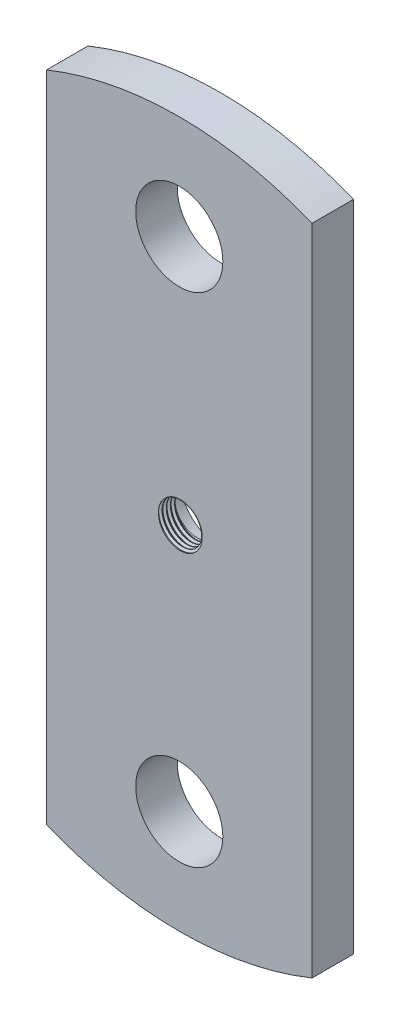
from build123d import *

# Parameters (mm, degrees)
SKETCH1_R           = 10.5
SKETCH1_R_2         = 10
SKETCH1_R_3         = 5
BOSS_EXTRUDE1_DEPTH = 10
SKETCH1_7_R         = 10
SKETCH1_7_R_2       = 5
CUT_EXTRUDE2_DEPTH  = 5.5
THREAD1_PITCH       = 1


with BuildPart() as part:
    # Sketch1 → Boss-Extrude1 (new body)
    # profile 1 of 2: a face of its own
    with BuildSketch(Plane.XY):
        with BuildLine():
            Line((-32, 78.74642849), (-32, -78.74642849))
            ThreePointArc((-32, -78.74642849), (0, -85), (32, -78.74642849))
            Line((32, -78.74642849), (32, 78.74642849))
            ThreePointArc((32, 78.74642849), (0, 85), (-32, 78.74642849))
        make_face()
        with Locations((0, -60)):
            Circle(SKETCH1_R, mode=Mode.SUBTRACT)
        with Locations((0, 60)):
            Circle(SKETCH1_R, mode=Mode.SUBTRACT)
        Circle(SKETCH1_R_2, mode=Mode.SUBTRACT)
    # profile 2 of 2: a face of its own
    with BuildSketch(Plane.XY):
        Circle(SKETCH1_R_2)
        Circle(SKETCH1_R_3, mode=Mode.SUBTRACT)
    extrude(amount=BOSS_EXTRUDE1_DEPTH)

    # Sketch1<7> → Cut-Extrude2 (cut)
    with BuildSketch(Plane.XY):
        Circle(SKETCH1_7_R)
        Circle(SKETCH1_7_R_2, mode=Mode.SUBTRACT)
    extrude(amount=CUT_EXTRUDE2_DEPTH, mode=Mode.SUBTRACT)

    # Thread1: the profile of Thread Profile1 profile screwed along a right-hand helix of 30 turns, 8 arcs to a turn; built about Z, then put on its axis
    thread1_z = Axis((0, 0, 0), (0, 0, 1))
    thread1_corners = [(4.9997, 0, -0.000173205), (4.9997, 0, 0.875173202), (5.541265875, 0, 0.562499999), (5.541265875, 0, 0.312499999)]
    with BuildLine(mode=Mode.PRIVATE) as thread1_profile:
        Line(thread1_corners[0], thread1_corners[1])
        Line(thread1_corners[1], thread1_corners[2])
        Line(thread1_corners[2], thread1_corners[3])
        Line(thread1_corners[3], thread1_corners[0])
    thread1_cap = Face(thread1_profile.wire())
    thread1_turn_angles = [0, 22.5, 45, 67.5, 90, 112.5, 135, 157.5, 180, 202.5, 225, 247.5, 270, 292.5, 315, 337.5, 360]
    thread1_turn_weights = [1, 0.9238795325112867, 1, 0.9238795325112867, 1, 0.9238795325112867, 1, 0.9238795325112867, 1, 0.9238795325112867, 1, 0.9238795325112867, 1, 0.9238795325112867, 1, 0.9238795325112867, 1]
    thread1_turn_rails = [Edge.make_bspline([Vector(p[0], p[1], 0).rotate(thread1_z, thread1_turn_angles[k]) / thread1_turn_weights[k] + Vector(0, 0, p[2] + THREAD1_PITCH * thread1_turn_angles[k] / 360) for k in range(17)], [0, 0, 0, 1, 1, 2, 2, 3, 3, 4, 4, 5, 5, 6, 6, 7, 7, 8, 8, 8], 2, thread1_turn_weights) for p in thread1_corners]
    thread1_turn_sides = [Face.make_surface_from_curves(thread1_turn_rails[p[0]], thread1_turn_rails[p[1]]) for p in [(0, 1), (1, 2), (2, 3), (3, 0)]]
    thread1 = Plane(origin=(0, 0, 20), x_dir=(-1, 0, 0), z_dir=(0, 0, -1)) * Solid(Shell([*[p.moved(Location((0, 0, THREAD1_PITCH * i))) for i in range(30) for p in thread1_turn_sides], thread1_cap, thread1_cap.rotate(thread1_z, 10800).moved(Location((0, 0, THREAD1_PITCH * 10800 / 360)))]))
    add(thread1, mode=Mode.SUBTRACT)


solid = part.part
